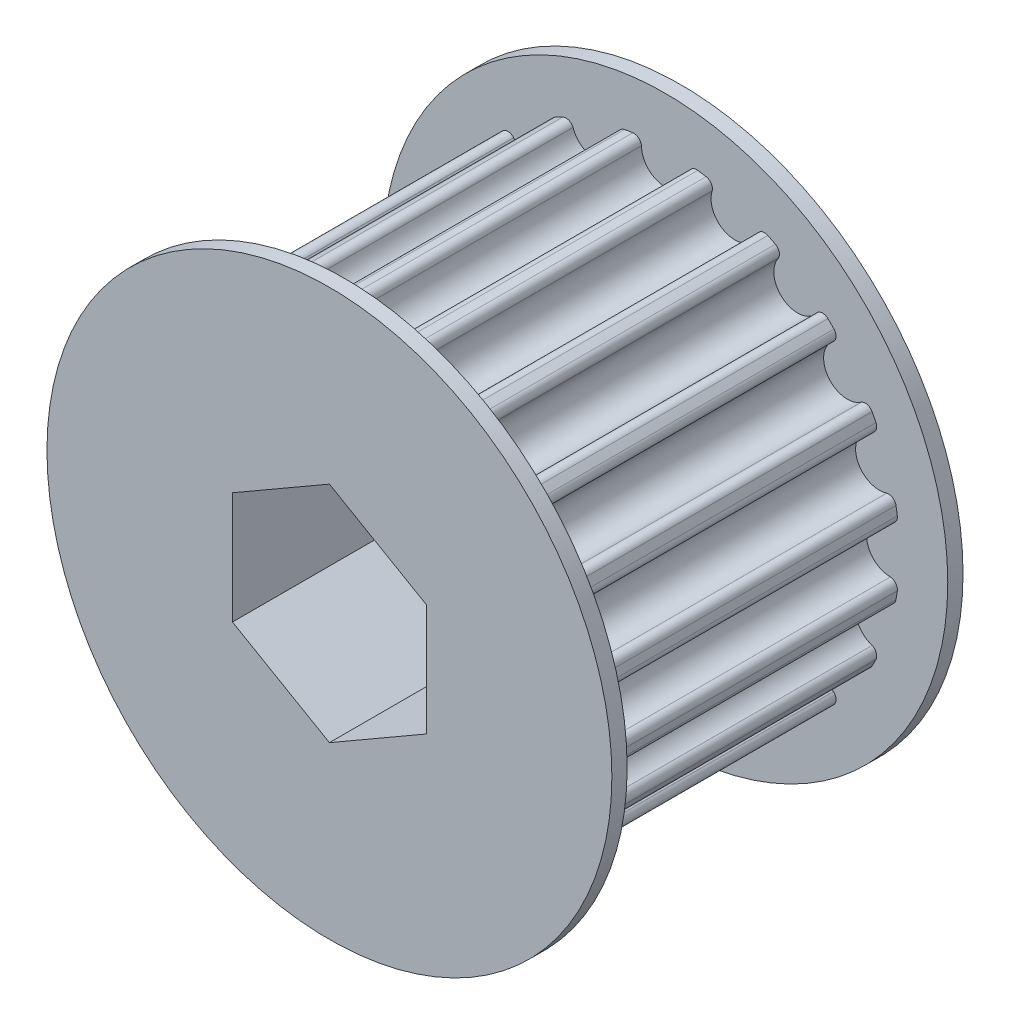
from build123d import *

# Parameters (mm, degrees)
SKETCH2_R                = 15.343994309
BOSS_EXTRUDE1_DEPTH      = 21
CUT_EXTRUDE1_DEPTH       = 31.19728999
FILLET1_R                = 0.5
CIRPATTERN1_COUNT        = 20
FILLET1_OF_CIRPATTERN1_R = 0.5
CUT_EXTRUDE2_DEPTH       = 31.051908029
SKETCH7_R                = 18.5
BOSS_EXTRUDE2_DEPTH      = 1


with BuildPart() as part:
    # Sketch2 → Boss-Extrude1 (new body)
    with BuildSketch(Plane.XY):
        Circle(SKETCH2_R)
    extrude(amount=BOSS_EXTRUDE1_DEPTH)

    # Sketch3 → Cut-Extrude1 (cut, through all)
    with BuildSketch(Plane(origin=(0, 0, 0), x_dir=(-1, 0, 0), z_dir=(0, 0, -1))):
        with BuildLine():
            Line((-1.614471729, 15.258821789), (-1.56, 14.743994309))
            ThreePointArc((-1.56, 14.743994309), (0, 13.183994309), (1.56, 14.743994309))
            Line((1.56, 14.743994309), (1.614471729, 15.258821789))
            ThreePointArc((1.614471729, 15.258821789), (0, 15.343994309), (-1.614471729, 15.258821789))
        make_face()
    cut_extrude1 = extrude(amount=-CUT_EXTRUDE1_DEPTH, mode=Mode.SUBTRACT)

    # Fillet1
    fillet1_edges = [part.edges().sort_by_distance(p)[0] for p in [
        (-1.614471729, 15.258821789, 10.5),
        (1.614471729, 15.258821789, 10.5),
    ]]
    fillet(fillet1_edges, radius=FILLET1_R)

    # CirPattern1: Cut-Extrude1 ×20 about axis
    cirpattern1_axis = Axis((0, 0, 0), (0, 0, 1))
    for i in range(1, CIRPATTERN1_COUNT):
        add(cut_extrude1.rotate(cirpattern1_axis, i * 360 / CIRPATTERN1_COUNT), mode=Mode.SUBTRACT)

    # Fillet1 of CirPattern1
    fillet1_of_cirpattern1_edges = [part.edges().sort_by_distance(p)[0] for p in [
        (-6.250689106, 14.013102692, 10.5),
        (-3.179781388, 15.010901095, 10.5),
        (-10.275045481, 11.395683469, 10.5),
        (-7.662775349, 13.293608814, 10.5),
        (-13.293608814, 7.662775349, 10.5),
        (-11.395683469, 10.275045481, 10.5),
        (-15.010901095, 3.179781388, 10.5),
        (-14.013102692, 6.250689106, 10.5),
        (-15.258821789, -1.614471729, 10.5),
        (-15.258821789, 1.614471729, 10.5),
        (-14.013102692, -6.250689106, 10.5),
        (-15.010901095, -3.179781388, 10.5),
        (-11.395683469, -10.275045481, 10.5),
        (-13.293608814, -7.662775349, 10.5),
        (-7.662775349, -13.293608814, 10.5),
        (-10.275045481, -11.395683469, 10.5),
        (-3.179781388, -15.010901095, 10.5),
        (-6.250689106, -14.013102692, 10.5),
        (1.614471729, -15.258821789, 10.5),
        (-1.614471729, -15.258821789, 10.5),
        (6.250689106, -14.013102692, 10.5),
        (3.179781388, -15.010901095, 10.5),
        (10.275045481, -11.395683469, 10.5),
        (7.662775349, -13.293608814, 10.5),
        (13.293608814, -7.662775349, 10.5),
        (11.395683469, -10.275045481, 10.5),
        (15.010901095, -3.179781388, 10.5),
        (14.013102692, -6.250689106, 10.5),
        (15.258821789, 1.614471729, 10.5),
        (15.258821789, -1.614471729, 10.5),
        (14.013102692, 6.250689106, 10.5),
        (15.010901095, 3.179781388, 10.5),
        (11.395683469, 10.275045481, 10.5),
        (13.293608814, 7.662775349, 10.5),
        (7.662775349, 13.293608814, 10.5),
        (10.275045481, 11.395683469, 10.5),
        (3.179781388, 15.010901095, 10.5),
        (6.250689106, 14.013102692, 10.5),
    ]]
    fillet(fillet1_of_cirpattern1_edges, radius=FILLET1_OF_CIRPATTERN1_R)

    # Sketch5 → Cut-Extrude2 (cut, through all)
    with BuildSketch(Plane(origin=(0, 0, 0), x_dir=(-1, 0, 0), z_dir=(0, 0, -1))):
        Polygon((0, -7.332348419), (6.35, -3.666174209), (6.35, 3.666174209), (0, 7.332348419), (-6.35, 3.666174209), (-6.35, -3.666174209), align=None)
    extrude(amount=-CUT_EXTRUDE2_DEPTH, mode=Mode.SUBTRACT)

    # Sketch7 → Boss-Extrude2 (add)
    with BuildSketch(Plane.XY.offset(21)):
        Circle(SKETCH7_R)
        Polygon((6.35, -3.666174209), (0, -7.332348419), (-6.35, -3.666174209), (-6.35, 3.666174209), (0, 7.332348419), (6.35, 3.666174209), align=None, mode=Mode.SUBTRACT)
    boss_extrude2 = extrude(amount=BOSS_EXTRUDE2_DEPTH)

    # Mirror1: Boss-Extrude2 across plane
    add(boss_extrude2.mirror(Plane.XY.offset(10.5)))


solid = part.part
